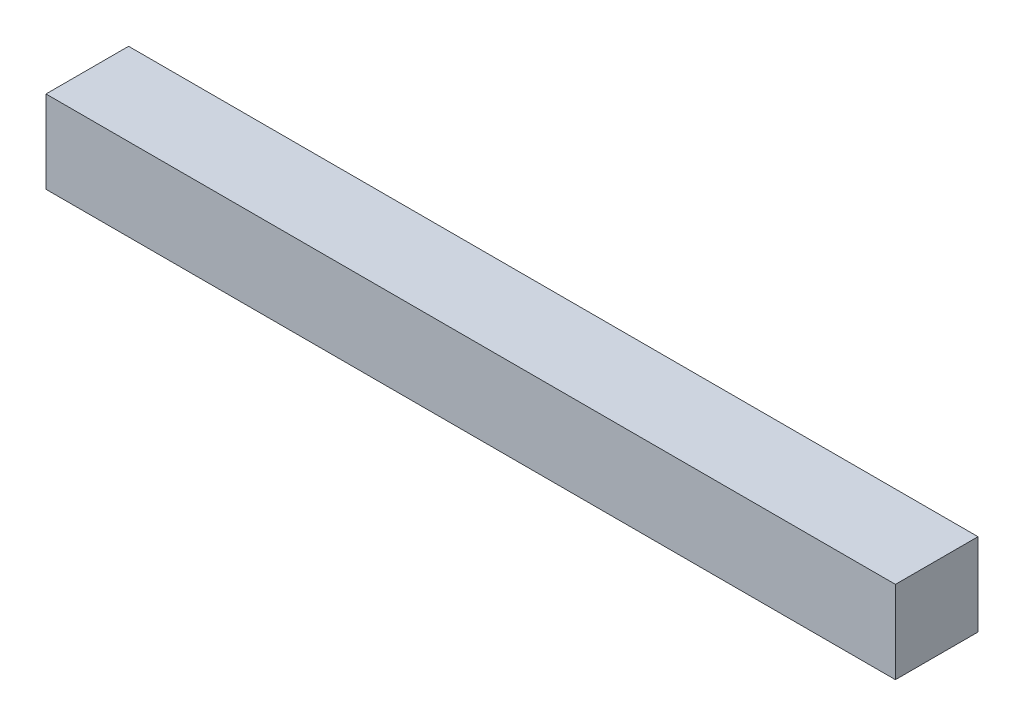
from build123d import *

# Parameters (mm, degrees)
SKETCH1_W           = 14
SKETCH1_H           = 14
BOSS_EXTRUDE1_DEPTH = 144


with BuildPart() as part:
    # Sketch1 → Boss-Extrude1 (new body)
    with BuildSketch(Plane(origin=(0, 0, 0), x_dir=(0, 0, -1), z_dir=(1, 0, 0))):
        Rectangle(SKETCH1_W, SKETCH1_H)
    extrude(amount=BOSS_EXTRUDE1_DEPTH)


solid = part.part
